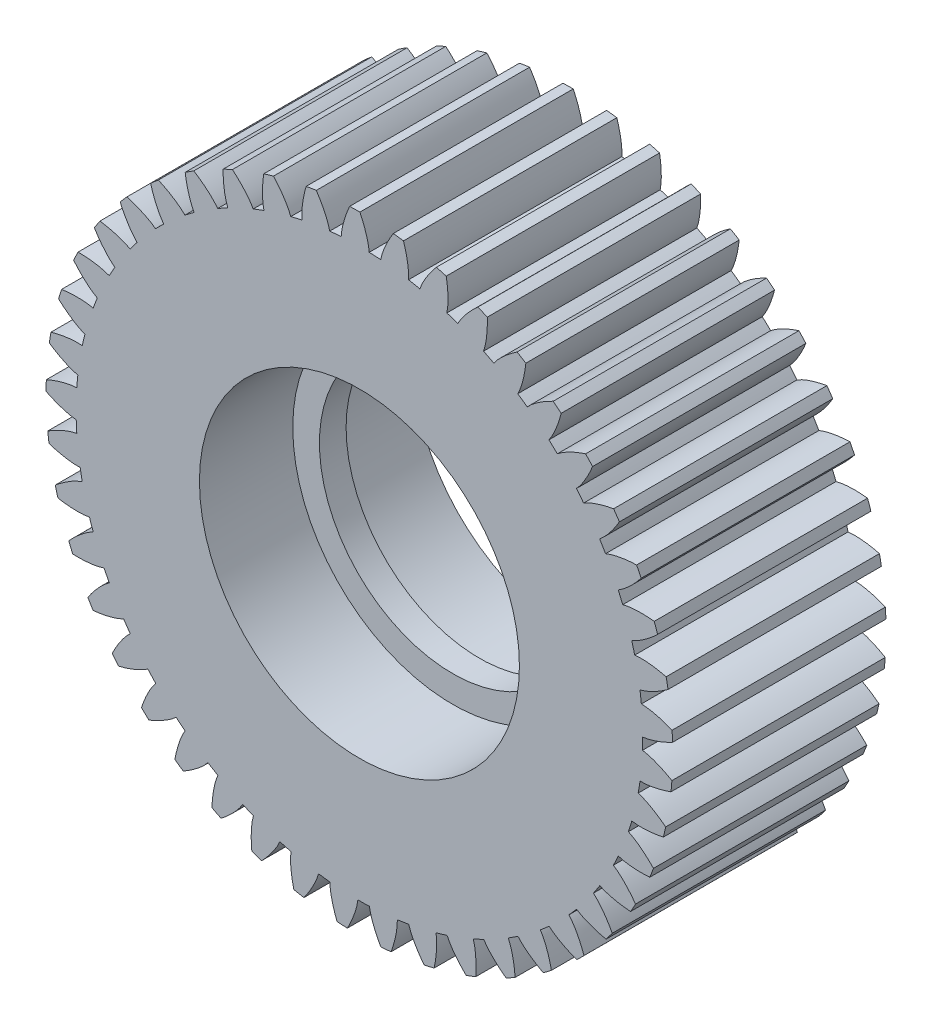
from build123d import *

# Parameters (mm, degrees)
SKETCH1_R           = 11.75
BOSS_EXTRUDE1_DEPTH = 4
CUT_EXTRUDE1_DEPTH  = 18.091664635
CIRPATTERN2_COUNT   = 45
SKETCH3_R           = 6
CUT_EXTRUDE2_DEPTH  = 3.5
SKETCH4_R           = 5
CUT_EXTRUDE3_DEPTH  = 18.215492201


with BuildPart() as part:
    # Sketch1 → Boss-Extrude1 (new, symmetric)
    with BuildSketch(Plane.XY):
        Circle(SKETCH1_R)
    extrude(amount=BOSS_EXTRUDE1_DEPTH, both=True)

    # Sketch2 → Cut-Extrude1 (cut, symmetric)
    with BuildSketch(Plane.XY):
        with BuildLine():
            ThreePointArc((10.624999392, 0.003595268), (10.624999848, 0.001797634), (10.625, 0))
            ThreePointArc((10.625, 0), (10.622874603, -0.212509217), (10.616499263, -0.424933414))
            ThreePointArc((10.616499263, -0.424933414), (10.616427217, -0.426729604), (10.616354867, -0.428525781))
            add(Edge.make_bspline(
                [(10.616354867, -0.428525781), (10.622076814, -0.429334901), (10.639811758, -0.431973772), (10.66958409, -0.43703214), (10.717182741, -0.446424848), (10.776759081, -0.460173752), (10.841917538, -0.477309965), (10.912428547, -0.498132126), (10.982408219, -0.520825248), (11.051847724, -0.545242364), (11.120669303, -0.5711663), (11.203588773, -0.604450647), (11.302378108, -0.646973177), (11.41683626, -0.700452239), (11.540328669, -0.762977995), (11.632545132, -0.813334103), (11.691456256, -0.846805695), (11.718312501, -0.862352666)],
                knots=[0.019933851, 0.019933851, 0.019933851, 0.019933851, 0.019933851, 0.02853182, 0.04661014, 0.064854849, 0.092110525, 0.119476176, 0.146842496, 0.174208854, 0.201574956, 0.228941013, 0.256307345, 0.307035032, 0.361767352, 0.416499661, 0.462763449, 0.462763449, 0.462763449, 0.462763449, 0.462763449], degree=4))
            ThreePointArc((11.718312501, -0.862352666), (11.742075453, -0.431467327), (11.75, 0))
            ThreePointArc((11.75, 0), (11.74835632, 0.196529323), (11.74342574, 0.393003662))
            add(Edge.make_bspline(
                [(10.624999392, 0.003595268), (10.630749121, 0.004174899), (10.648575414, 0.006102372), (10.678526229, 0.009965985), (10.726462447, 0.017447532), (10.786540992, 0.028802755), (10.852332658, 0.043319327), (10.923620011, 0.061304831), (10.994451276, 0.081181049), (11.064811757, 0.102801485), (11.134615068, 0.125952247), (11.218799362, 0.155893706), (11.319210293, 0.19443126), (11.435715699, 0.243289927), (11.561609944, 0.300826735), (11.655766555, 0.347454474), (11.7159692, 0.378543211), (11.74342574, 0.393003662)],
                knots=[0.019933851, 0.019933851, 0.019933851, 0.019933851, 0.019933851, 0.02853182, 0.04661014, 0.064854849, 0.092110525, 0.119476176, 0.146842496, 0.174208854, 0.201574956, 0.228941013, 0.256307345, 0.307035032, 0.361767352, 0.416499661, 0.462763449, 0.462763449, 0.462763449, 0.462763449, 0.462763449], degree=4))
        make_face()
    cut_extrude1 = extrude(amount=CUT_EXTRUDE1_DEPTH, both=True, mode=Mode.SUBTRACT)

    # CirPattern2: Cut-Extrude1 ×45 about axis
    cirpattern2_axis = Axis((0, 0, 4), (0, 0, -1))
    for i in range(1, CIRPATTERN2_COUNT):
        add(cut_extrude1.rotate(cirpattern2_axis, i * 360 / CIRPATTERN2_COUNT), mode=Mode.SUBTRACT)

    # Sketch3 → Cut-Extrude2 (cut)
    with BuildSketch(Plane.XY.offset(4)):
        Circle(SKETCH3_R)
    cut_extrude2 = extrude(amount=-CUT_EXTRUDE2_DEPTH, mode=Mode.SUBTRACT)

    # Sketch4 → Cut-Extrude3 (cut, through all)
    with BuildSketch(Plane.XY.offset(0.5)):
        Circle(SKETCH4_R)
    extrude(amount=-CUT_EXTRUDE3_DEPTH, mode=Mode.SUBTRACT)

    # Mirror1: Cut-Extrude2 across plane
    add(cut_extrude2.mirror(Plane.XY), mode=Mode.SUBTRACT)


solid = part.part
